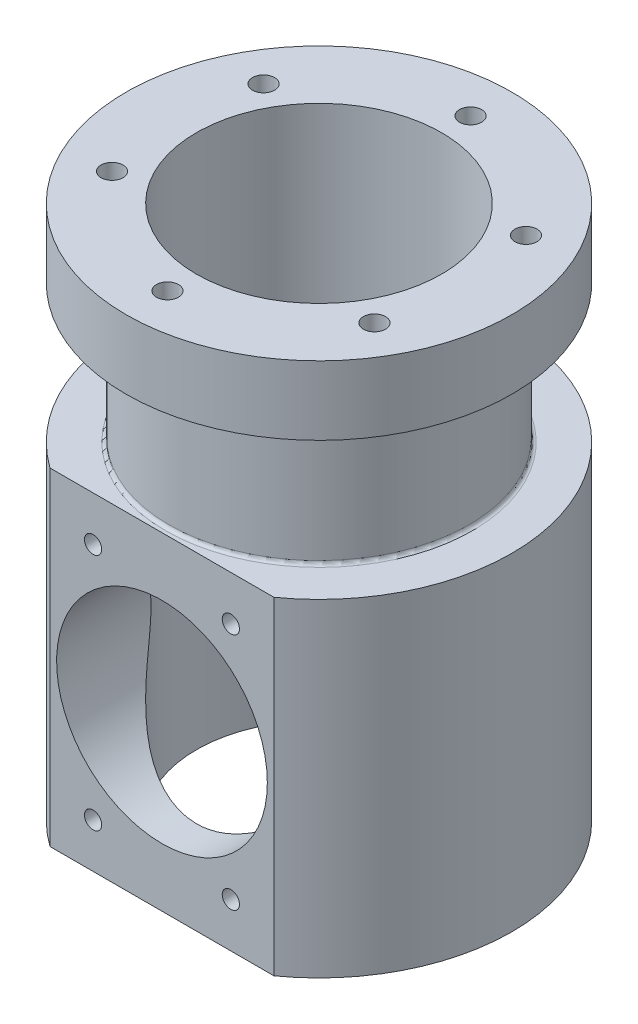
from build123d import *

# Parameters (mm, degrees)
SKETCH1_R                = 7.15
SKETCH1_R_2              = 6.65
BOSS_EXTRUDE1_DEPTH      = 15
BOSS_EXTRUDE2_DEPTH      = 26.9
BOSS_EXTRUDE2_DEPTH_BACK = 11.9
SKETCH2_R                = 14
SKETCH2_R_2              = 8.9
CUT_EXTRUDE12_START      = -15
SKETCH50_R               = 14
SKETCH50_R_2             = 10.9
CUT_EXTRUDE12_DEPTH      = 10
CUT_EXTRUDE8_DEPTH       = 10
CUT_EXTRUDE8_DEPTH_BACK  = 21.28
SKETCH30_R               = 7.65
CIRPATTERN3_COUNT        = 6
BOSS_EXTRUDE3_REACH      = 49.179
BOSS_EXTRUDE3_END_RADIUS = 7.65
SKETCH39_R               = 0.8
CUT_EXTRUDE11_START      = 2.5
SKETCH38_R               = 11.53
CUT_EXTRUDE11_DEPTH      = 10
CUT_EXTRUDE13_DEPTH      = 39.000263325
CUT_EXTRUDE13_DEPTH_BACK = 39.000263325
SKETCH51_W               = 20.008016057
SKETCH51_H               = 32.534282003
CIRPATTERN4_COUNT        = 6
FILLET1_R                = 0.25


with BuildPart() as part:
    # Sketch1 → Boss-Extrude1 (new body)
    with BuildSketch(Plane.XY):
        Circle(SKETCH1_R)
        Circle(SKETCH1_R_2, mode=Mode.SUBTRACT)
    extrude(amount=BOSS_EXTRUDE1_DEPTH)

    # Sketch2 → Boss-Extrude2 (add, two sides: drawn at the far end of the back side and taken through both)
    with BuildSketch(Plane(origin=(0, 0, 0), x_dir=(1, 0, 0), z_dir=(0, 1, 0)).offset(-BOSS_EXTRUDE2_DEPTH_BACK)):
        with Locations((0, 8.9)):
            Circle(SKETCH2_R)
        with Locations((0, 8.9)):
            Circle(SKETCH2_R_2, mode=Mode.SUBTRACT)
    extrude(amount=BOSS_EXTRUDE2_DEPTH + BOSS_EXTRUDE2_DEPTH_BACK)

    # Sketch50 → Cut-Extrude12 (cut)
    with BuildSketch(Plane(origin=(0, 26.9, 0), x_dir=(1, 0, 0), z_dir=(0, 1, 0)).offset(CUT_EXTRUDE12_START)):
        with Locations((0, 8.9)):
            Circle(SKETCH50_R)
        with Locations((0, 8.9)):
            Circle(SKETCH50_R_2, mode=Mode.SUBTRACT)
    extrude(amount=CUT_EXTRUDE12_DEPTH, mode=Mode.SUBTRACT)

    # Sketch30 → Cut-Extrude8 (cut, two sides: drawn at the far end of the back side and taken through both)
    with BuildSketch(Plane.XY.offset(15).offset(-CUT_EXTRUDE8_DEPTH_BACK)):
        Circle(SKETCH30_R)
    extrude(amount=CUT_EXTRUDE8_DEPTH + CUT_EXTRUDE8_DEPTH_BACK, mode=Mode.SUBTRACT)

    # Sketch47 → Tap Drill for M2 Tap1 (revolve, cut)
    with BuildSketch(Plane(origin=(0, 26.9, 2.1), x_dir=(0, 0, 1), z_dir=(1, 0, 0))):
        Polygon((0, 0), (0, 4.480688495), (0.8, 4), (0.8, 0), align=None)
    tap_drill_for_m2_tap1 = revolve(axis=Axis((0, 33.25, 2.1), (0, -1, 0)), mode=Mode.SUBTRACT)

    # CirPattern3: Tap Drill for M2 Tap1 ×6 about axis
    cirpattern3_axis = Axis((0, -11.9, -8.9), (0, 1, 0))
    for i in range(1, CIRPATTERN3_COUNT):
        add(tap_drill_for_m2_tap1.rotate(cirpattern3_axis, i * 360 / CIRPATTERN3_COUNT), mode=Mode.SUBTRACT)

    # Mirror1 copy 1 sketch → Mirror1 copy 1 (revolve, cut)
    with BuildSketch(Plane(origin=(9.526279442, -11.9, -3.4), x_dir=(0.8660254037844386, 0, 0.5000000000000001), z_dir=(0.5000000000000001, 0, -0.8660254037844386))):
        Polygon((0, 0), (0, -4.480688495), (0.8, -4), (0.8, 0), align=None)
    revolve(axis=Axis((9.526279442, -18.25, -3.4), (0, -1, 0)), mode=Mode.SUBTRACT)

    # Mirror1 copy 2 sketch → Mirror1 copy 2 (revolve, cut)
    with BuildSketch(Plane(origin=(9.526279442, -11.9, -14.4), x_dir=(0.8660254037844387, 0, -0.4999999999999998), z_dir=(-0.4999999999999998, 0, -0.8660254037844387))):
        Polygon((0, 0), (0, -4.480688495), (0.8, -4), (0.8, 0), align=None)
    revolve(axis=Axis((9.526279442, -18.25, -14.4), (0, -1, 0)), mode=Mode.SUBTRACT)

    # Mirror1 copy 3 sketch → Mirror1 copy 3 (revolve, cut)
    with BuildSketch(Plane(origin=(0, -11.9, -19.9), x_dir=(0, 0, -1), z_dir=(-1, 0, 0))):
        Polygon((0, 0), (0, -4.480688495), (0.8, -4), (0.8, 0), align=None)
    revolve(axis=Axis((0, -18.25, -19.9), (0, -1, 0)), mode=Mode.SUBTRACT)

    # Mirror1 copy 4 sketch → Mirror1 copy 4 (revolve, cut)
    with BuildSketch(Plane(origin=(-9.526279442, -11.9, -14.4), x_dir=(-0.8660254037844384, 0, -0.5000000000000004), z_dir=(-0.5000000000000004, 0, 0.8660254037844384))):
        Polygon((0, 0), (0, -4.480688495), (0.8, -4), (0.8, 0), align=None)
    revolve(axis=Axis((-9.526279442, -18.25, -14.4), (0, -1, 0)), mode=Mode.SUBTRACT)

    # Mirror1 copy 5 sketch → Mirror1 copy 5 (revolve, cut)
    with BuildSketch(Plane(origin=(-9.526279442, -11.9, -3.4), x_dir=(-0.8660254037844386, 0, 0.5000000000000001), z_dir=(0.5000000000000001, 0, 0.8660254037844386))):
        Polygon((0, 0), (0, -4.480688495), (0.8, -4), (0.8, 0), align=None)
    revolve(axis=Axis((-9.526279442, -18.25, -3.4), (0, -1, 0)), mode=Mode.SUBTRACT)

    # Mirror1 copy 6 sketch → Mirror1 copy 6 (revolve, cut)
    with BuildSketch(Plane(origin=(0, -11.9, 2.1), x_dir=(0, 0, 1), z_dir=(1, 0, 0))):
        Polygon((0, 0), (0, -4.480688495), (0.8, -4), (0.8, 0), align=None)
    revolve(axis=Axis((0, -18.25, 2.1), (0, -1, 0)), mode=Mode.SUBTRACT)

    # Boss-Extrude3: up to this cylinder (the profile starts outside it)
    boss_extrude3_end = Plane(origin=(0, 0, 2.1), z_dir=(0, 0, -1)) * Cylinder(BOSS_EXTRUDE3_END_RADIUS, 114.658, mode=Mode.PRIVATE)
    # Sketch39 → Boss-Extrude3 (add, up to the surface)
    with BuildSketch(Plane.XZ.offset(11.9), mode=Mode.PRIVATE) as boss_extrude3_sk1:
        with Locations((0, 2.1)):
            Circle(SKETCH39_R)
    boss_extrude3_tool1 = extrude(boss_extrude3_sk1.sketch, amount=-BOSS_EXTRUDE3_REACH, mode=Mode.PRIVATE) - boss_extrude3_end
    add(boss_extrude3_tool1.solids().sort_by_distance((0, -11.9, 2.1))[0])

    # Sketch38 → Cut-Extrude11 (cut)
    with BuildSketch(Plane.XY.offset(CUT_EXTRUDE11_START)):
        Circle(SKETCH38_R)
    extrude(amount=CUT_EXTRUDE11_DEPTH, mode=Mode.SUBTRACT)

    # Sketch51 → Cut-Extrude13 (cut, two sides: drawn at the far end of the back side and taken through both)
    with BuildSketch(Plane(origin=(0, 0, 0), x_dir=(0, 0, -1), z_dir=(1, 0, 0)).offset(-CUT_EXTRUDE13_DEPTH_BACK)):
        with Locations((-12.504008029, -1.384089117)):
            Rectangle(SKETCH51_W, SKETCH51_H)
    extrude(amount=CUT_EXTRUDE13_DEPTH + CUT_EXTRUDE13_DEPTH_BACK, mode=Mode.SUBTRACT)

    # Sketch49 → Tap Drill for M1.6 Tap1 (revolve, cut)
    with BuildSketch(Plane(origin=(-5, 8.660254038, 2.5), x_dir=(0, -1, 0), z_dir=(1, 0, 0))):
        Polygon((0, 0), (0, 3.375537887), (0.625, 3), (0.625, 0), align=None)
    tap_drill_for_m1_6_tap1 = revolve(axis=Axis((-5, 8.660254038, 8.85), (0, 0, -1)), mode=Mode.SUBTRACT)

    # CirPattern4: Tap Drill for M1.6 Tap1 ×6 about axis, 2 skipped
    cirpattern4_axis = Axis((0, 0, 25), (0, 0, 1))
    add([tap_drill_for_m1_6_tap1.rotate(cirpattern4_axis, i * 360 / CIRPATTERN4_COUNT) for i in range(1, CIRPATTERN4_COUNT) if i not in (1, 4)], mode=Mode.SUBTRACT)

    # Fillet1
    fillet1_edges = [part.edges().sort_by_distance(p)[0] for p in [
        (-10.9, 21.9, -8.9),
        (-10.9, 11.9, -8.9),
    ]]
    fillet(fillet1_edges, radius=FILLET1_R)


solid = part.part
